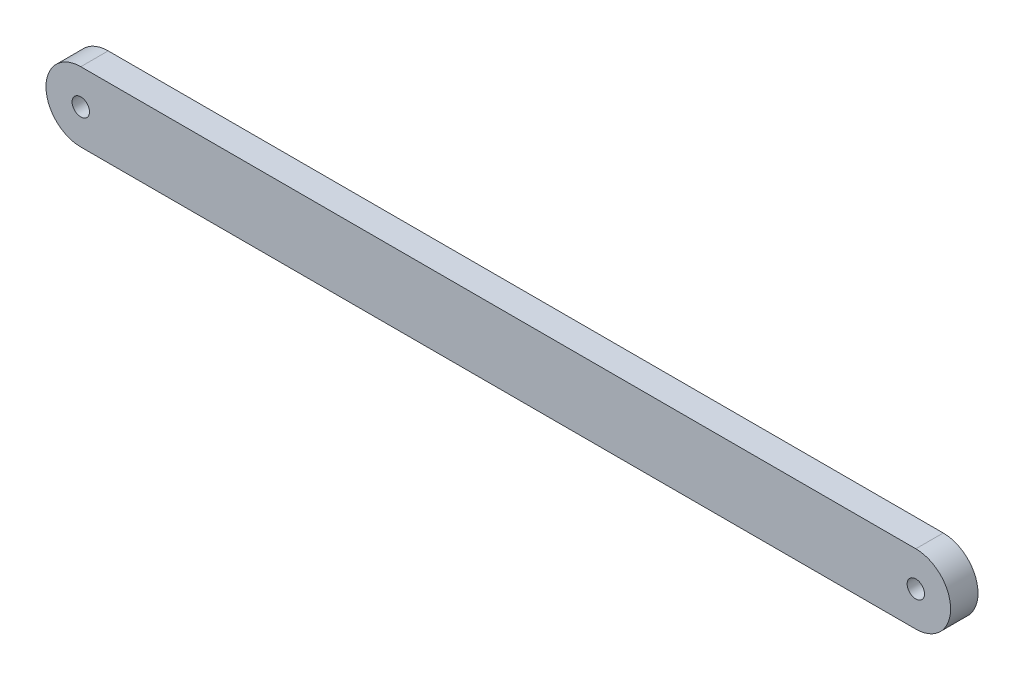
from build123d import *

# Parameters (mm, degrees)
SKETCH1_R           = 3.175
BOSS_EXTRUDE1_DEPTH = 10


with BuildPart() as part:
    # Sketch1 → Boss-Extrude1 (new body)
    with BuildSketch(Plane.XY):
        with BuildLine():
            Line((0, 12.7), (304.8, 12.7))
            ThreePointArc((304.8, 12.7), (317.5, 0), (304.8, -12.7))
            Line((304.8, -12.7), (0, -12.7))
            ThreePointArc((0, -12.7), (-12.7, 0), (0, 12.7))
        make_face()
        Circle(SKETCH1_R, mode=Mode.SUBTRACT)
        with Locations((304.8, 0)):
            Circle(SKETCH1_R, mode=Mode.SUBTRACT)
    extrude(amount=BOSS_EXTRUDE1_DEPTH)


solid = part.part
